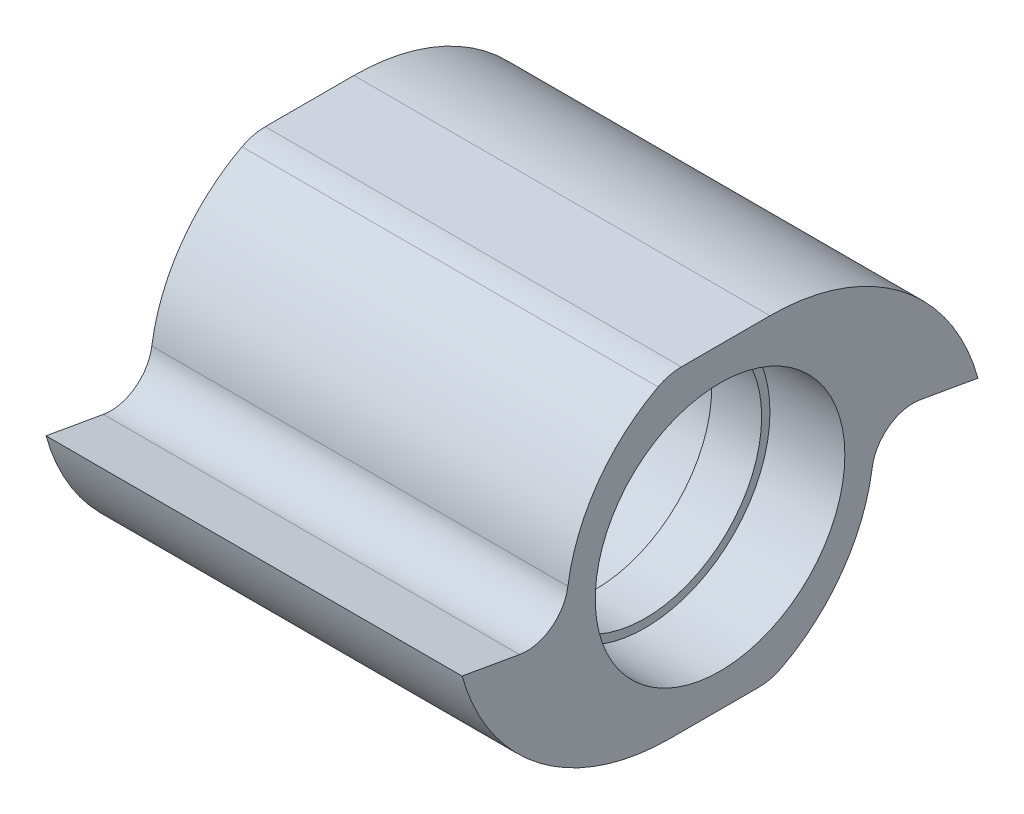
from build123d import *

# Parameters (mm, degrees)
BOSS_EXTRUDE1_DEPTH      = 25
FILLET2_R                = 6
CIRPATTERN1_COUNT        = 2
FILLET2_OF_CIRPATTERN1_R = 6
FILLET1_R                = 5
SKETCH4_R                = 14
CUT_EXTRUDE1_DEPTH       = 62.822326226
SKETCH5_R                = 17.5
CUT_EXTRUDE2_DEPTH       = 25
SKETCH6_R                = 15
CUT_EXTRUDE3_DEPTH       = 10
CUT_EXTRUDE4_START       = -9
SKETCH7_R                = 15
CUT_EXTRUDE4_DEPTH       = 9


with BuildPart() as part:
    # Sketch1 → Boss-Extrude1 (new, symmetric)
    with BuildSketch(Plane(origin=(0, 0, 0), x_dir=(0, 0, -1), z_dir=(1, 0, 0))):
        with BuildLine():
            Line((-31, 0), (-18.365369315, -2.227826281))
            ThreePointArc((-18.365369315, -2.227826281), (-18.466311656, -1.115945268), (-18.5, 0))
            Line((-18.5, 0), (18.5, 0))
            ThreePointArc((18.5, 0), (15.094779432, -11.371565416), (6, -19))
            Line((6, -19), (-6, -19))
            ThreePointArc((-6, -19), (-21.700318468, -13.710945353), (-31, 0))
        make_face()
    boss_extrude1 = extrude(amount=BOSS_EXTRUDE1_DEPTH, both=True)

    # Fillet2
    fillet2_edges = [part.edges().sort_by_distance(p)[0] for p in [
        (0, -19, -6),
    ]]
    fillet(fillet2_edges, radius=FILLET2_R)

    # CirPattern1: Boss-Extrude1 ×2 about axis
    cirpattern1_axis = Axis((-27.5, 0, 0), (1, 0, 0))
    for i in range(1, CIRPATTERN1_COUNT):
        add(boss_extrude1.rotate(cirpattern1_axis, i * 360 / CIRPATTERN1_COUNT))

    # Fillet2 of CirPattern1
    fillet2_of_cirpattern1_edges = [part.edges().sort_by_distance(p)[0] for p in [
        (0, 19, 6),
    ]]
    fillet(fillet2_of_cirpattern1_edges, radius=FILLET2_OF_CIRPATTERN1_R)

    # Fillet1
    fillet1_edges = [part.edges().sort_by_distance(p)[0] for p in [
        (0, 2.227826281, -18.365369315),
        (0, -2.227826281, 18.365369315),
    ]]
    fillet(fillet1_edges, radius=FILLET1_R)

    # Sketch4 → Cut-Extrude1 (cut, through all)
    with BuildSketch(Plane(origin=(25, 0, 0), x_dir=(0, 0, -1), z_dir=(1, 0, 0))):
        Circle(SKETCH4_R)
    extrude(amount=-CUT_EXTRUDE1_DEPTH, mode=Mode.SUBTRACT)

    # Sketch5 → Cut-Extrude2 (cut)
    with BuildSketch(Plane.ZY.offset(25)):
        Circle(SKETCH5_R)
    extrude(amount=-CUT_EXTRUDE2_DEPTH, mode=Mode.SUBTRACT)

    # Sketch6 → Cut-Extrude3 (cut)
    with BuildSketch(Plane.ZY):
        Circle(SKETCH6_R)
    extrude(amount=-CUT_EXTRUDE3_DEPTH, mode=Mode.SUBTRACT)

    # Sketch7 → Cut-Extrude4 (cut)
    with BuildSketch(Plane(origin=(25, 0, 0), x_dir=(0, 0, -1), z_dir=(1, 0, 0)).offset(CUT_EXTRUDE4_START)):
        Circle(SKETCH7_R)
    extrude(amount=CUT_EXTRUDE4_DEPTH, mode=Mode.SUBTRACT)


solid = part.part
